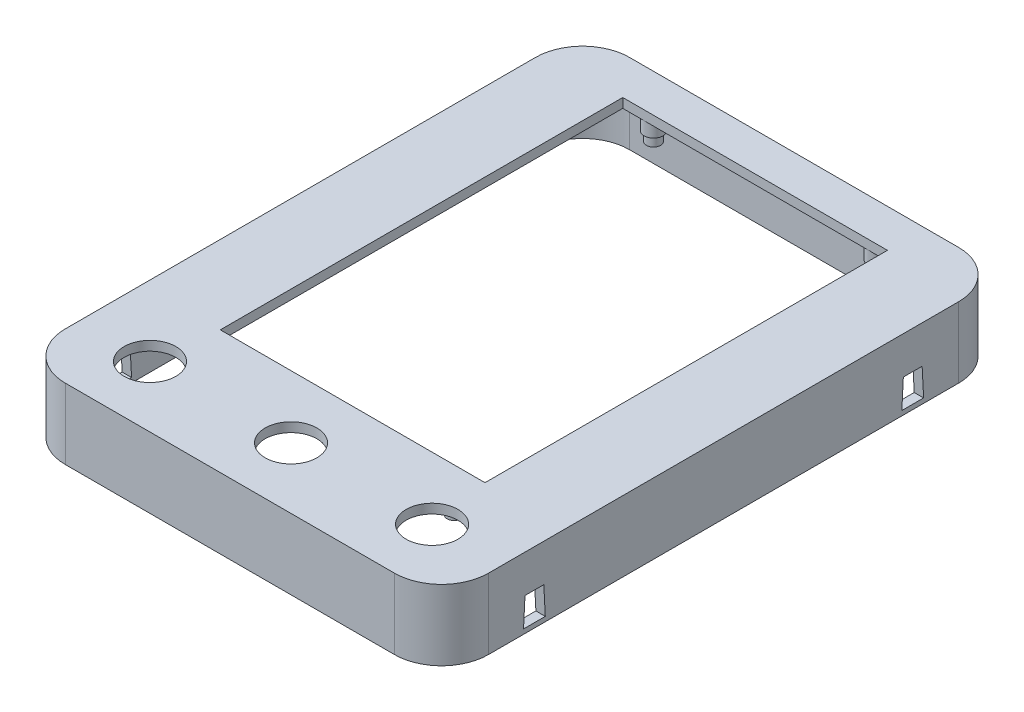
from build123d import *

# Parameters (mm, degrees)
CROQUIS1_W               = 90
CROQUIS1_H               = 120
SALIENTE_EXTRUIR1_DEPTH  = 15
VACIADO1_T               = -2
CROQUIS3_W               = 56.3
CROQUIS3_H               = 85.6
CORTAR_EXTRUIR1_DEPTH    = 10
CROQUIS4_R               = 2
SALIENTE_EXTRUIR2_DEPTH  = 3
CROQUIS5_R               = 1.5
SALIENTE_EXTRUIR3_DEPTH  = 2
CROQUIS6_R               = 5.5
CORTAR_EXTRUIR2_DEPTH    = 4
REDONDEO1_R              = 10
RANURA_START             = 43
RANURA_DE_RESORTE1_DEPTH = 2
CORTAR_EXTRUIR3_DEPTH    = 110.201648339


# Read off the part's stored shape, not the designer's step: Ranura de resorte1
with BuildPart() as part:
    # Croquis1 → Saliente-Extruir1 (new body)
    with BuildSketch(Plane(origin=(0, 0, 0), x_dir=(1, 0, 0), z_dir=(0, 1, 0))):
        Rectangle(CROQUIS1_W, CROQUIS1_H)
    extrude(amount=SALIENTE_EXTRUIR1_DEPTH)

    # Vaciado1
    vaciado1_openings = [part.faces().sort_by_distance(p)[0] for p in [
        (0, 0, 0),
    ]]
    offset(amount=VACIADO1_T, openings=vaciado1_openings, kind=Kind.INTERSECTION)

    # Croquis3 → Cortar-Extruir1 (cut)
    with BuildSketch(Plane(origin=(0, 15, 0), x_dir=(1, 0, 0), z_dir=(0, 1, 0))):
        with Locations((-0.189097346, 9.095595484)):
            Rectangle(CROQUIS3_W, CROQUIS3_H)
    extrude(amount=-CORTAR_EXTRUIR1_DEPTH, mode=Mode.SUBTRACT)

    # Croquis4 → Saliente-Extruir2 (add)
    with BuildSketch(Plane.XZ.offset(-13)):
        with Locations(Location((-23.989097346, 35.904404516, 0), (0, 0, 270))):
            Circle(CROQUIS4_R)
        with Locations(Location((23.610902654, 35.904404516, 0), (0, 0, 270))):
            Circle(CROQUIS4_R)
        with Locations(Location((-23.989097346, -54.095595484, 0), (0, 0, 270))):
            Circle(CROQUIS4_R)
        with Locations(Location((23.610902654, -54.095595484, 0), (0, 0, 270))):
            Circle(CROQUIS4_R)
    extrude(amount=SALIENTE_EXTRUIR2_DEPTH)

    # Croquis5 → Saliente-Extruir3 (add)
    with BuildSketch(Plane.XZ.offset(-10)):
        with Locations(Location((-23.989097346, -54.095595484, 0), (0, 0, 270))):
            Circle(CROQUIS5_R)
        with Locations(Location((23.610902654, -54.095595484, 0), (0, 0, 270))):
            Circle(CROQUIS5_R)
        with Locations(Location((23.610902654, 35.904404516, 0), (0, 0, 270))):
            Circle(CROQUIS5_R)
        with Locations(Location((-23.989097346, 35.904404516, 0), (0, 0, 270))):
            Circle(CROQUIS5_R)
    extrude(amount=SALIENTE_EXTRUIR3_DEPTH)

    # Croquis6 → Cortar-Extruir2 (cut)
    with BuildSketch(Plane(origin=(0, 15, 0), x_dir=(1, 0, 0), z_dir=(0, 1, 0))):
        with Locations(Location((-30, -47, 0), (0, 0, 270))):
            Circle(CROQUIS6_R)
        with Locations(Location((0, -47, 0), (0, 0, 270))):
            Circle(CROQUIS6_R)
        with Locations(Location((30, -47, 0), (0, 0, 270))):
            Circle(CROQUIS6_R)
    extrude(amount=-CORTAR_EXTRUIR2_DEPTH, mode=Mode.SUBTRACT)

    # Redondeo1
    redondeo1_edges = [part.edges().sort_by_distance(p)[0] for p in [
        (-43, 6.5, -58),
        (-43, 6.5, 58),
        (43, 6.5, 58),
        (43, 6.5, -58),
        (-45, 7.5, -60),
        (45, 7.5, -60),
        (45, 7.5, 60),
        (-45, 7.5, 60),
    ]]
    fillet(redondeo1_edges, radius=REDONDEO1_R)

    # Ranura de resorte1 outline → Ranura de resorte1 (cut)
    with BuildSketch(Plane.YZ.offset(RANURA_START)):
        Polygon((7, -38.234845775), (1, -37.9203991), (1, -42.549292451), (7, -42.234845775), align=None)
    extrude(amount=RANURA_DE_RESORTE1_DEPTH, mode=Mode.SUBTRACT)

    # Croquis7 → Cortar-Extruir3 (cut, through all)
    with BuildSketch(Plane(origin=(45, 0, 0), x_dir=(0, 0, -1), z_dir=(1, 0, 0))):
        Polygon((42.549292451, 1), (37.9203991, 1), (38.234845775, 7), (42.234845775, 7), align=None)
        Polygon((-42.234845775, 7), (-42.549292451, 1), (-37.9203991, 1), (-38.234845775, 7), align=None)
    extrude(amount=-CORTAR_EXTRUIR3_DEPTH, mode=Mode.SUBTRACT)


solid = part.part
